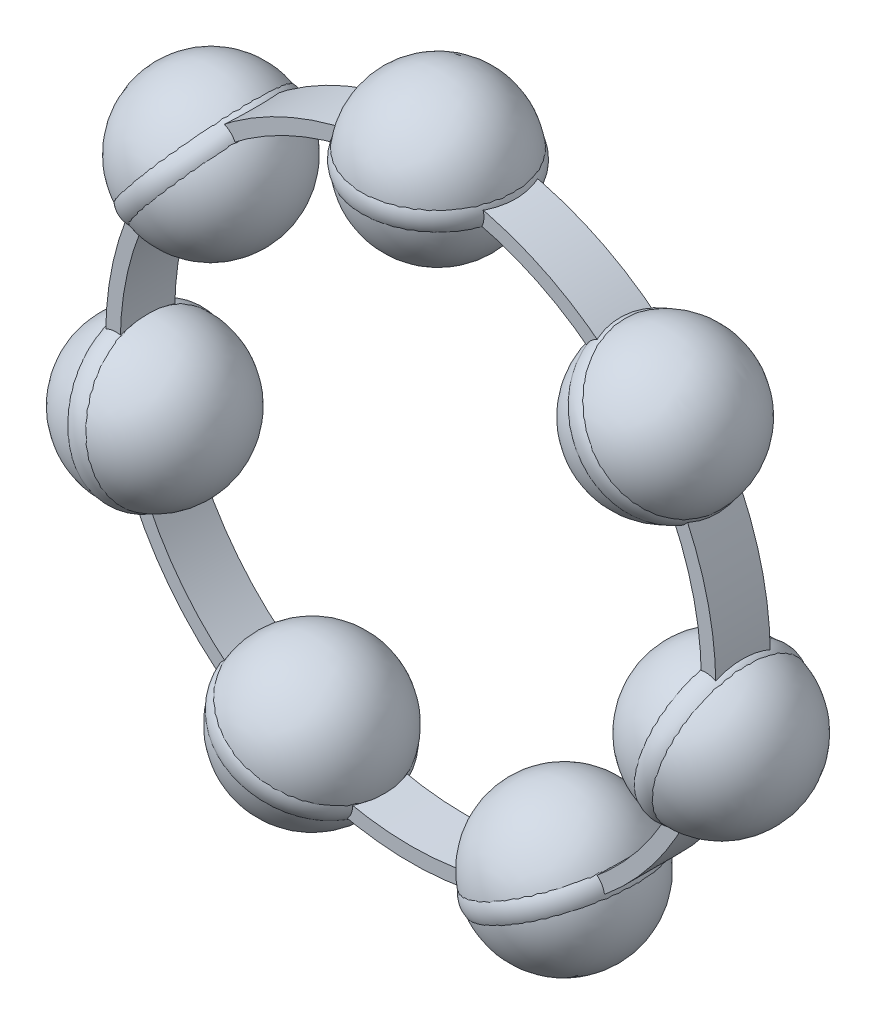
from build123d import *

# Parameters (mm, degrees)
CIRPATTERN1_COUNT   = 7
SKETCH9_R           = 6.6675
SKETCH9_R_2         = 6.35
BOSS_EXTRUDE1_DEPTH = 0.5953125


with BuildPart() as part:
    # Sketch4 → Revolve4 (revolve)
    with BuildSketch(Plane(origin=(0, 0, 0), x_dir=(0, 0, -1), z_dir=(1, 0, 0))):
        with BuildLine():
            Line((-1.675964142, 6.35), (1.675964142, 6.35))
            ThreePointArc((1.675964142, 6.35), (0, 8.025964142), (-1.675964142, 6.35))
        make_face()
    revolve(axis=Axis((0, 6.35, 1.675964142), (0, 0, -1)))


with BuildPart() as body_2:
    # Sketch8 → Revolve7 (revolve)
    with BuildSketch(Plane(origin=(0, 0, 0), x_dir=(0, 0, -1), z_dir=(1, 0, 0))):
        with BuildLine():
            Line((-1.351649998, 6.6675), (-1.589395831, 6.6675))
            ThreePointArc((-1.589395831, 6.6675), (-1.708268748, 6.35), (-1.589395831, 6.0325))
            Line((-1.589395831, 6.0325), (-1.351649998, 6.0325))
            ThreePointArc((-1.351649998, 6.0325), (-1.388439399, 6.35), (-1.351649998, 6.6675))
        make_face()
    revolve(axis=Axis((0, 7.9375, 0), (0, -1, 0)))


with BuildPart() as cirpattern1_1:
    # CirPattern1: pattern copy
    add(body_2.part.rotate(Axis((0, 0, 3.571875), (0, 0, -1)), 1 * 360 / CIRPATTERN1_COUNT))


with BuildPart() as cirpattern1_2:
    # CirPattern1: pattern copy
    add(body_2.part.rotate(Axis((0, 0, 3.571875), (0, 0, -1)), 2 * 360 / CIRPATTERN1_COUNT))


with BuildPart() as cirpattern1_3:
    # CirPattern1: pattern copy
    add(body_2.part.rotate(Axis((0, 0, 3.571875), (0, 0, -1)), 3 * 360 / CIRPATTERN1_COUNT))


with BuildPart() as cirpattern1_4:
    # CirPattern1: pattern copy
    add(body_2.part.rotate(Axis((0, 0, 3.571875), (0, 0, -1)), 4 * 360 / CIRPATTERN1_COUNT))


with BuildPart() as cirpattern1_5:
    # CirPattern1: pattern copy
    add(body_2.part.rotate(Axis((0, 0, 3.571875), (0, 0, -1)), 5 * 360 / CIRPATTERN1_COUNT))


with BuildPart() as cirpattern1_6:
    # CirPattern1: pattern copy
    add(body_2.part.rotate(Axis((0, 0, 3.571875), (0, 0, -1)), 6 * 360 / CIRPATTERN1_COUNT))


with BuildPart() as cirpattern1_7:
    # CirPattern1: pattern copy
    add(part.part.rotate(Axis((0, 0, 3.571875), (0, 0, -1)), 1 * 360 / CIRPATTERN1_COUNT))


with BuildPart() as cirpattern1_8:
    # CirPattern1: pattern copy
    add(part.part.rotate(Axis((0, 0, 3.571875), (0, 0, -1)), 2 * 360 / CIRPATTERN1_COUNT))


with BuildPart() as cirpattern1_9:
    # CirPattern1: pattern copy
    add(part.part.rotate(Axis((0, 0, 3.571875), (0, 0, -1)), 3 * 360 / CIRPATTERN1_COUNT))


with BuildPart() as cirpattern1_10:
    # CirPattern1: pattern copy
    add(part.part.rotate(Axis((0, 0, 3.571875), (0, 0, -1)), 4 * 360 / CIRPATTERN1_COUNT))


with BuildPart() as cirpattern1_11:
    # CirPattern1: pattern copy
    add(part.part.rotate(Axis((0, 0, 3.571875), (0, 0, -1)), 5 * 360 / CIRPATTERN1_COUNT))


with BuildPart() as cirpattern1_12:
    # CirPattern1: pattern copy
    add(part.part.rotate(Axis((0, 0, 3.571875), (0, 0, -1)), 6 * 360 / CIRPATTERN1_COUNT))


with BuildPart() as body_15:
    # Sketch9 → Boss-Extrude1 (new, symmetric)
    with BuildSketch(Plane.XY):
        Circle(SKETCH9_R)
        Circle(SKETCH9_R_2, mode=Mode.SUBTRACT)
    extrude(amount=BOSS_EXTRUDE1_DEPTH, both=True)


solid = Compound([part.part, body_2.part, cirpattern1_1.part, cirpattern1_2.part, cirpattern1_3.part, cirpattern1_4.part, cirpattern1_5.part, cirpattern1_6.part, cirpattern1_7.part, cirpattern1_8.part, cirpattern1_9.part, cirpattern1_10.part, cirpattern1_11.part, cirpattern1_12.part, body_15.part])
